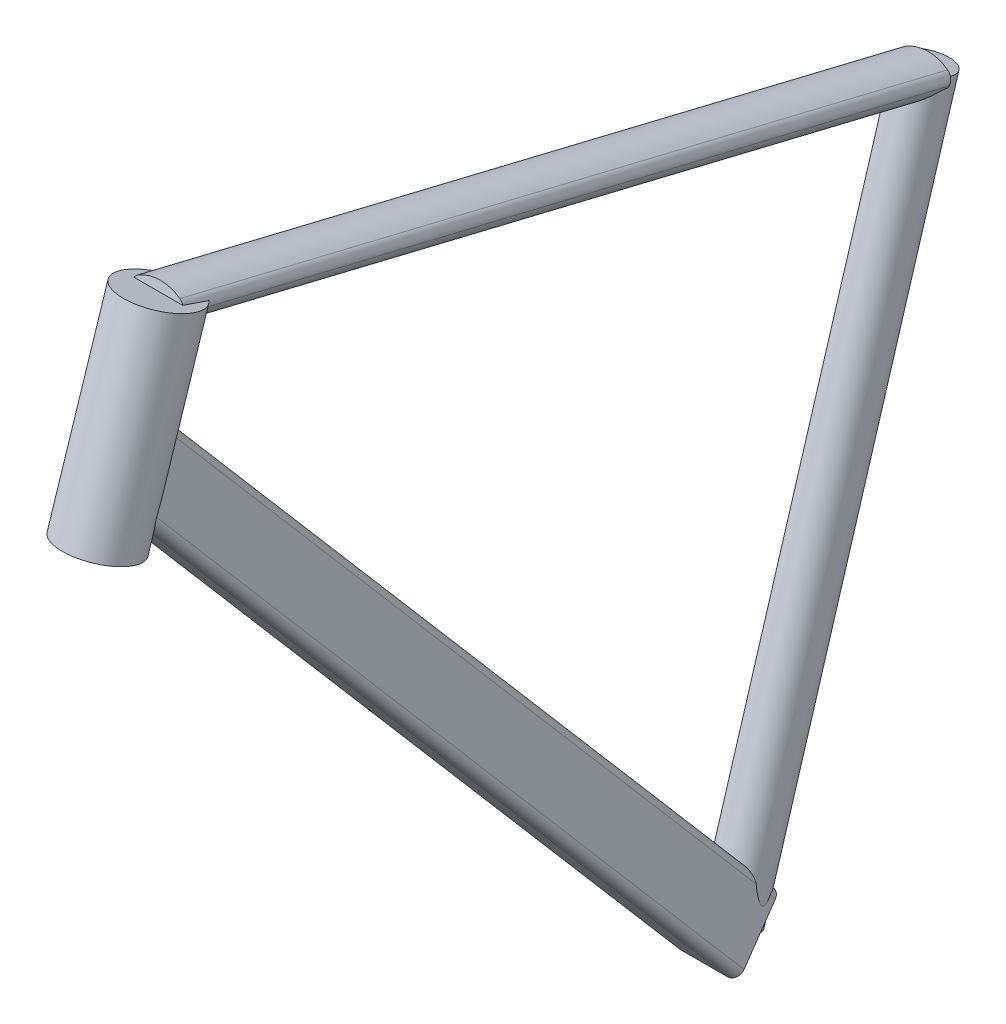
from build123d import *

# Parameters (mm, degrees)
BOSS_EXTRU_1_DEPTH      = 640
BOSS_EXTRU_2_DEPTH      = 85.149524
BOSS_EXTRU_2_DEPTH_BACK = 50
ESQUISSE3_R             = 25
ESQUISSE4_R             = 16.25
BOSS_EXTRU_3_DEPTH      = 460
BOSS_EXTRU_4_DEPTH      = 538.374334
CONG_2_R                = 6


with BuildPart() as part:
    # Esquisse2 → Boss.-Extru.1 (new body)
    with BuildSketch(Plane(origin=(0, 0, 0), x_dir=(1, 0, 0), z_dir=(0, 0.7592713073348772, 0.6507742172658553))):
        with BuildLine():
            Line((15, 20.050960192), (21.8, -17.06884777))
            ThreePointArc((21.8, -17.06884777), (20.507273753, -21.991424646), (15.8982113, -24.15))
            Line((15.8982113, -24.15), (-15.8982113, -24.15))
            ThreePointArc((-15.8982113, -24.15), (-20.507273753, -21.991424646), (-21.8, -17.06884777))
            Line((-21.8, -17.06884777), (-15, 20.050960192))
            ThreePointArc((-15, 20.050960192), (-13.283029955, 22.990885377), (-10.08184275, 24.15))
            Line((-10.08184275, 24.15), (10.08184275, 24.15))
            ThreePointArc((10.08184275, 24.15), (13.283029955, 22.990885377), (15, 20.050960192))
        make_face()
    extrude(amount=BOSS_EXTRU_1_DEPTH)

    # Esquisse3 → Boss.-Extru.2 (add, two sides: drawn at the far end of the back side and taken through both)
    with BuildSketch(Plane(origin=(0, 318.21229454, -102.77977066), x_dir=(1, 0, 0), z_dir=(0, 0.9515944038794392, -0.3073566177998039)).offset(-BOSS_EXTRU_2_DEPTH_BACK)):
        with Locations(Location((0, -545.689705187, 0), (0, 0, 270))):
            Circle(ESQUISSE3_R)
    extrude(amount=BOSS_EXTRU_2_DEPTH + BOSS_EXTRU_2_DEPTH_BACK)

    # Esquisse4 → Boss.-Extru.3 (add)
    with BuildSketch(Plane(origin=(0, 0, 0), x_dir=(-1, 0, 0), z_dir=(0, -0.9573194975320661, 0.2890317969444757))):
        with Locations(Location((0, 0, 0), (0, 0, 90))):
            Circle(ESQUISSE4_R)
    extrude(amount=-BOSS_EXTRU_3_DEPTH)

    # Esquisse6 → Boss.-Extru.4 (add)
    with BuildSketch(Plane(origin=(0, 120.556524575, 498.320946029), x_dir=(-1, 0, 0), z_dir=(0, -0.2351421131025904, -0.9719610005785463))):
        with BuildLine():
            ThreePointArc((-18, 459.282751524), (0, 465.282751524), (18, 459.282751524))
            ThreePointArc((18, 459.282751524), (0, 442.793800531), (-18, 459.282751524))
        make_face()
    extrude(amount=BOSS_EXTRU_4_DEPTH)

    # Congé2
    # the kernel refuses this fillet: 6 mm, written as the material it takes off along each edge
    with BuildSketch(Plane(origin=(18, 569.964853237, 402.73882153), x_dir=(-0.22741249255017482, -0.946494184199431, 0.22898104181082424), z_dir=(0, -0.2351421131025904, -0.9719610005785463))) as cong_2_piece_1_section:
        with BuildLine():
            CenterArc((4.260838332, 5.939736355), CONG_2_R, 194.8000963, 83.327345661)
            ThreePointArc((-1.540099424, 4.407052057), (-0.855904465, 2.173523012), (0, 0))
            ThreePointArc((0, 0), (2.554545336, -0.181486341), (5.109090673, 0))
        make_face()
    cong_2_piece_1 = extrude(amount=563.919787364, mode=Mode.PRIVATE)
    cong_2_piece_1 = cong_2_piece_1 & Plane(origin=(0, 568.063071542, 389.968414387), x_dir=(0, 0.3073566177998039, 0.9515944038794392), z_dir=(0, -0.9515944038794392, 0.3073566177998039)) * Cylinder(25, 1149, mode=Mode.PRIVATE)
    cong_2_piece_1 = split(cong_2_piece_1, bisect_by=Plane(origin=(16.531120585, 565.028684893, 384.340281993), z_dir=(0, 0.9515944038794392, -0.3073566177998039)), keep=Keep.TOP, mode=Mode.PRIVATE)
    add(cong_2_piece_1, mode=Mode.SUBTRACT)
    with BuildSketch(Plane(origin=(18, 569.964853237, 402.73882153), x_dir=(-0.22741249255017482, -0.946494184199431, 0.22898104181082424), z_dir=(0, -0.2351421131025904, -0.9719610005785463))) as cong_2_piece_2_section:
        with BuildLine():
            CenterArc((4.260838332, 5.939736355), CONG_2_R, 194.8000963, 83.327345661)
            ThreePointArc((-1.540099424, 4.407052057), (-0.855904465, 2.173523012), (0, 0))
            ThreePointArc((0, 0), (2.554545336, -0.181486341), (5.109090673, 0))
        make_face()
    cong_2_piece_2 = extrude(amount=563.919787364, mode=Mode.PRIVATE)
    cong_2_piece_2 = cong_2_piece_2 - Plane(origin=(0, 566.037180728, 390.622759291), x_dir=(0, 0.3073566177998039, 0.9515944038794392), z_dir=(0, -0.9515944038794392, 0.3073566177998039)) * Cylinder(25, 1149, mode=Mode.PRIVATE)
    cong_2_piece_2 = split(cong_2_piece_2, bisect_by=Plane(origin=(17.327256681, 557.452909942, 360.885231308), z_dir=(0, -0.9515944038794392, 0.3073566177998039)), keep=Keep.TOP, mode=Mode.PRIVATE)
    add(cong_2_piece_2, mode=Mode.SUBTRACT)
    with BuildSketch(Plane(origin=(18, 569.964853237, 402.73882153), x_dir=(-0.22741249255017482, -0.946494184199431, 0.22898104181082424), z_dir=(0, -0.2351421131025904, -0.9719610005785463))) as cong_2_piece_3_section:
        with BuildLine():
            CenterArc((4.260838332, 5.939736355), CONG_2_R, 194.8000963, 83.327345661)
            ThreePointArc((-1.540099424, 4.407052057), (-0.855904465, 2.173523012), (0, 0))
            ThreePointArc((0, 0), (2.554545336, -0.181486341), (5.109090673, 0))
        make_face()
    cong_2_piece_3 = extrude(amount=563.919787364, mode=Mode.PRIVATE)
    cong_2_piece_3 = cong_2_piece_3 - Plane(origin=(0, 586.929479421, 383.874730679), x_dir=(0, 0.3073566177998039, 0.9515944038794392), z_dir=(0, -0.9515944038794392, 0.3073566177998039)) * Cylinder(25, 1149, mode=Mode.PRIVATE)
    cong_2_piece_3 = split(cong_2_piece_3, bisect_by=Plane(origin=(17.019495371, 479.016491503, 118.04140585), z_dir=(0, 0.9515944038794392, -0.3073566177998039)), keep=Keep.TOP, mode=Mode.PRIVATE)
    add(cong_2_piece_3, mode=Mode.SUBTRACT)
    with BuildSketch(Plane(origin=(-18, 569.964853237, 402.73882153), x_dir=(0.2274124925501477, -0.9464941841994371, 0.22898104181082568), z_dir=(0, -0.2351421131025904, -0.9719610005785463))) as cong_2_piece_4_section:
        with BuildLine():
            CenterArc((4.260838332, -5.939736355), CONG_2_R, 81.872558039, 83.327345661)
            ThreePointArc((-1.540099424, -4.407052057), (-0.855904465, -2.173523012), (0, 0))
            ThreePointArc((0, 0), (2.554545336, 0.181486341), (5.109090673, 0))
        make_face()
    cong_2_piece_4 = extrude(amount=563.919787364, mode=Mode.PRIVATE)
    cong_2_piece_4 = cong_2_piece_4 & Plane(origin=(0, 568.063071521, 389.968414394), x_dir=(0, 0.3073566177998039, 0.9515944038794392), z_dir=(0, -0.9515944038794392, 0.3073566177998039)) * Cylinder(25, 1149, mode=Mode.PRIVATE)
    cong_2_piece_4 = split(cong_2_piece_4, bisect_by=Plane(origin=(-16.531120676, 565.028685588, 384.340284145), z_dir=(0, 0.9515944038794392, -0.3073566177998039)), keep=Keep.TOP, mode=Mode.PRIVATE)
    add(cong_2_piece_4, mode=Mode.SUBTRACT)
    with BuildSketch(Plane(origin=(-18, 569.964853237, 402.73882153), x_dir=(0.2274124925501477, -0.9464941841994371, 0.22898104181082568), z_dir=(0, -0.2351421131025904, -0.9719610005785463))) as cong_2_piece_5_section:
        with BuildLine():
            CenterArc((4.260838332, -5.939736355), CONG_2_R, 81.872558039, 83.327345661)
            ThreePointArc((-1.540099424, -4.407052057), (-0.855904465, -2.173523012), (0, 0))
            ThreePointArc((0, 0), (2.554545336, 0.181486341), (5.109090673, 0))
        make_face()
    cong_2_piece_5 = extrude(amount=563.919787364, mode=Mode.PRIVATE)
    cong_2_piece_5 = cong_2_piece_5 - Plane(origin=(0, 566.037180335, 390.622759418), x_dir=(0, 0.3073566177998039, 0.9515944038794392), z_dir=(0, -0.9515944038794392, 0.3073566177998039)) * Cylinder(25, 1149, mode=Mode.PRIVATE)
    cong_2_piece_5 = split(cong_2_piece_5, bisect_by=Plane(origin=(-17.327256673, 557.4529114, 360.885235823), z_dir=(0, -0.9515944038794392, 0.3073566177998039)), keep=Keep.TOP, mode=Mode.PRIVATE)
    add(cong_2_piece_5, mode=Mode.SUBTRACT)
    with BuildSketch(Plane(origin=(-18, 569.964853237, 402.73882153), x_dir=(0.2274124925501477, -0.9464941841994371, 0.22898104181082568), z_dir=(0, -0.2351421131025904, -0.9719610005785463))) as cong_2_piece_6_section:
        with BuildLine():
            CenterArc((4.260838332, -5.939736355), CONG_2_R, 81.872558039, 83.327345661)
            ThreePointArc((-1.540099424, -4.407052057), (-0.855904465, -2.173523012), (0, 0))
            ThreePointArc((0, 0), (2.554545336, 0.181486341), (5.109090673, 0))
        make_face()
    cong_2_piece_6 = extrude(amount=563.919787364, mode=Mode.PRIVATE)
    cong_2_piece_6 = cong_2_piece_6 - Plane(origin=(0, 586.92948104, 383.874730156), x_dir=(0, 0.3073566177998039, 0.9515944038794392), z_dir=(0, -0.9515944038794392, 0.3073566177998039)) * Cylinder(25, 1149, mode=Mode.PRIVATE)
    cong_2_piece_6 = split(cong_2_piece_6, bisect_by=Plane(origin=(-17.019495461, 479.016484464, 118.041384056), z_dir=(0, 0.9515944038794392, -0.3073566177998039)), keep=Keep.TOP, mode=Mode.PRIVATE)
    add(cong_2_piece_6, mode=Mode.SUBTRACT)


solid = part.part
